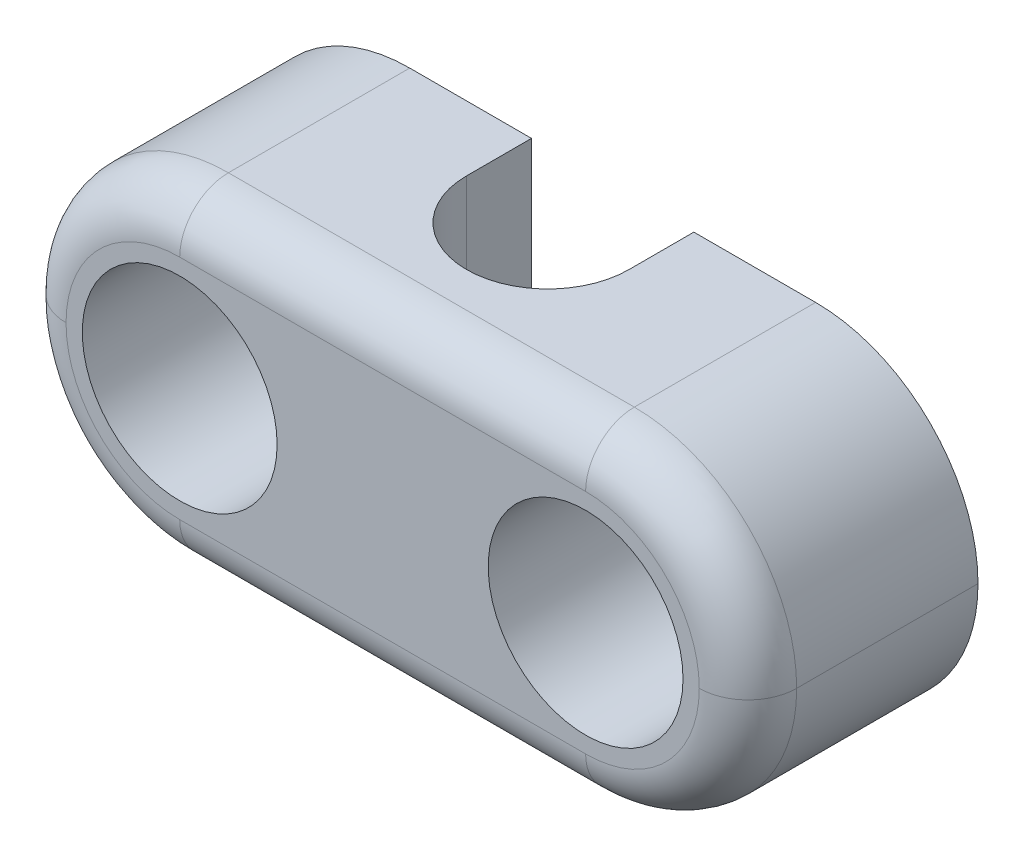
from build123d import *

# Parameters (mm, degrees)
SKETCH2_W                               = 45
SKETCH2_H                               = 20
BOSS_EXTRUDE2_DEPTH                     = 14.16787265
FILLET1_R                               = 10
CUT_EXTRUDE1_DEPTH                      = 22
CBORE_FOR_M5_HEX_HEAD_BOLT1_D           = 5.5
CBORE_FOR_M5_HEX_HEAD_BOLT1_CBORE_D     = 12
CBORE_FOR_M5_HEX_HEAD_BOLT1_CBORE_DEPTH = 10
FILLET2_R                               = 3


with BuildPart() as part:
    # Sketch2 → Boss-Extrude2 (new body)
    with BuildSketch(Plane.XY):
        Rectangle(SKETCH2_W, SKETCH2_H)
    extrude(amount=BOSS_EXTRUDE2_DEPTH)

    # Fillet1
    fillet1_edges = [part.edges().sort_by_distance(p)[0] for p in [
        (22.5, 10, 7.083936325),
        (22.5, -10, 7.083936325),
        (-22.5, 10, 7.083936325),
        (-22.5, -10, 7.083936325),
    ]]
    fillet(fillet1_edges, radius=FILLET1_R - 0.0001)  # a hair under: the kernel refuses the full size

    # Sketch3 → Cut-Extrude1 (cut)
    with BuildSketch(Plane.XZ.offset(10)):
        with BuildLine():
            Line((-5, 0), (-5, 4))
            ThreePointArc((-5, 4), (0, 9), (5, 4))
            Line((5, 4), (5, 0))
            ThreePointArc((5, 0), (0, -5), (-5, 0))
        make_face()
    extrude(amount=-CUT_EXTRUDE1_DEPTH, mode=Mode.SUBTRACT)

    # CBORE for M5 Hex Head Bolt1 (through all)
    with Locations(Plane.XY.offset(14.16787265)):
        with Locations((-12.5, 0), (12.5, 0)):
            CounterBoreHole(CBORE_FOR_M5_HEX_HEAD_BOLT1_D / 2, CBORE_FOR_M5_HEX_HEAD_BOLT1_CBORE_D / 2, CBORE_FOR_M5_HEX_HEAD_BOLT1_CBORE_DEPTH)

    # Fillet2
    fillet2_edges = [part.edges().sort_by_distance(p)[0] for p in [
        (0, 10, 14.16787265),
        (0, -10, 14.16787265),
        (-19.571097101, -7.071097101, 14.16787265),
        (-19.571097101, 7.071097101, 14.16787265),
        (19.571097101, -7.071097101, 14.16787265),
        (19.571097101, 7.071097101, 14.16787265),
    ]]
    fillet(fillet2_edges, radius=FILLET2_R)


solid = part.part
